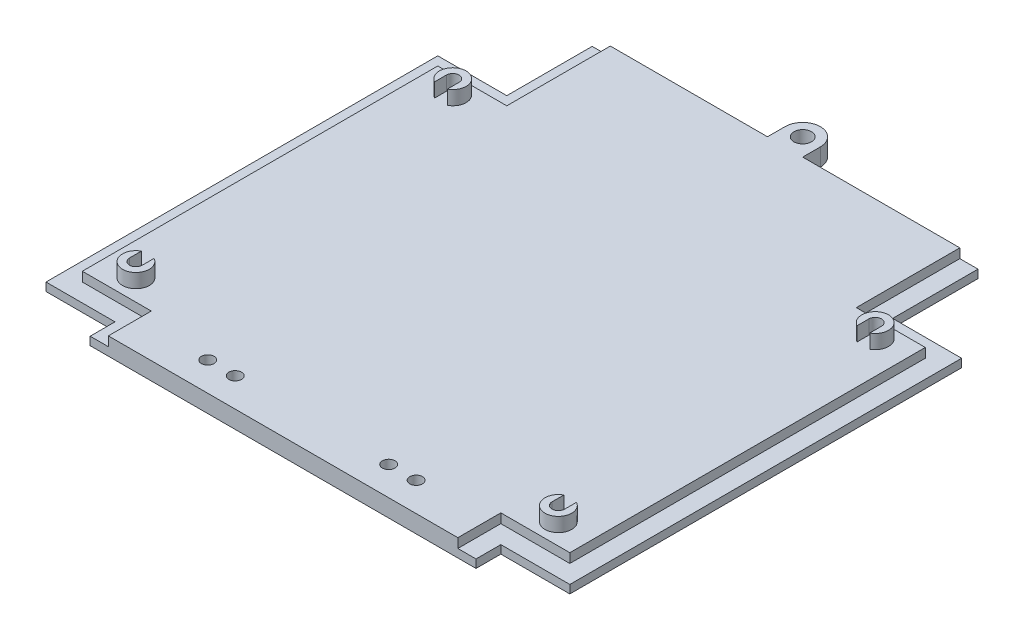
from build123d import *

# Parameters (mm, degrees)
BOSS_EXTRUDE1_DEPTH = 6.35
CUT_EXTRUDE1_DEPTH  = 3.375
SKETCH3_W           = 12.7
SKETCH3_H           = 12.7
BOSS_EXTRUDE2_DEPTH = 6.35
FILLET1_R           = 6.35
SKETCH4_R           = 3.175
CUT_EXTRUDE2_DEPTH  = 255.013969616
SKETCH5_R           = 2.286
CUT_EXTRUDE3_DEPTH  = 12.7
BOSS_EXTRUDE3_DEPTH = 5.08


with BuildPart() as part:
    # Sketch1 → Boss-Extrude1 (new body)
    with BuildSketch(Plane(origin=(0, 0, 0), x_dir=(1, 0, 0), z_dir=(0, 1, 0))):
        Polygon((0, 150.29942), (0, 181.102), (139.192, 181.102), (139.192, 150.29942), (164.084, 150.29942), (164.084, 8.95858), (139.192, 8.95858), (139.192, 0), (0, 0), (0, 8.95858), (-24.892, 8.95858), (-24.892, 150.29942), align=None)
    extrude(amount=BOSS_EXTRUDE1_DEPTH)

    # Sketch2 → Cut-Extrude1 (cut)
    with BuildSketch(Plane(origin=(0, 6.35, 0), x_dir=(1, 0, 0), z_dir=(0, 1, 0))):
        Polygon((132.6420004, 181.102), (132.6420004, 143.7494204), (157.5340004, 143.7494204), (157.5340004, 15.5085796), (132.6420004, 15.5085796), (132.6420004, 0), (139.192, 0), (139.192, 8.95858), (164.084, 8.95858), (164.084, 150.29942), (139.192, 150.29942), (139.192, 181.102), align=None)
        Polygon((0, 181.102), (6.5499996, 181.102), (6.5499996, 143.7494204), (-18.3420004, 143.7494204), (-18.3420004, 15.5085796), (6.5499996, 15.5085796), (6.5499996, 0), (0, 0), (0, 8.95858), (-24.892, 8.95858), (-24.892, 150.29942), (0, 150.29942), align=None)
    extrude(amount=-CUT_EXTRUDE1_DEPTH, mode=Mode.SUBTRACT)

    # Sketch3 → Boss-Extrude2 (add)
    with BuildSketch(Plane(origin=(0, 6.35, 0), x_dir=(1, 0, 0), z_dir=(0, 1, 0))):
        with Locations((69.596, 187.452)):
            Rectangle(SKETCH3_W, SKETCH3_H)
    extrude(amount=-BOSS_EXTRUDE2_DEPTH)

    # Fillet1
    fillet1_edges = [part.edges().sort_by_distance(p)[0] for p in [
        (63.246, 3.175, -193.802),
        (75.946, 3.175, -193.802),
    ]]
    fillet(fillet1_edges, radius=FILLET1_R - 0.0001)  # a hair under: the kernel refuses the full size

    # Sketch4 → Cut-Extrude2 (cut, through all)
    with BuildSketch(Plane(origin=(0, 6.35, 0), x_dir=(1, 0, 0), z_dir=(0, 1, 0))):
        with Locations(Location((69.596, 187.452, 0), (0, 0, 270))):
            Circle(SKETCH4_R)
    extrude(amount=-CUT_EXTRUDE2_DEPTH, mode=Mode.SUBTRACT)

    # Sketch5 → Cut-Extrude3 (cut)
    with BuildSketch(Plane.XZ):
        with Locations(Location((107.188, -10.414, 0), (0, 0, 270))):
            Circle(SKETCH5_R)
        with Locations(Location((97.282, -10.414, 0), (0, 0, 270))):
            Circle(SKETCH5_R)
        with Locations(Location((41.91, -10.414, 0), (0, 0, 270))):
            Circle(SKETCH5_R)
        with Locations(Location((32.004, -10.414, 0), (0, 0, 270))):
            Circle(SKETCH5_R)
    extrude(amount=-CUT_EXTRUDE3_DEPTH, mode=Mode.SUBTRACT)

    # Sketch6 → Boss-Extrude3 (add)
    with BuildSketch(Plane(origin=(0, 6.35, 0), x_dir=(1, 0, 0), z_dir=(0, 1, 0))):
        with BuildLine():
            Line((-4.318, 23.114), (-4.318, 27.364232935))
            ThreePointArc((-4.318, 27.364232935), (-6.604, 18.288), (-8.89, 27.364232935))
            Line((-8.89, 27.364232935), (-8.89, 23.114))
            ThreePointArc((-8.89, 23.114), (-6.604, 20.828), (-4.318, 23.114))
        make_face()
        with BuildLine():
            Line((-8.89, 137.414), (-8.89, 133.163767065))
            ThreePointArc((-8.89, 133.163767065), (-6.604, 142.24), (-4.318, 133.163767065))
            Line((-4.318, 133.163767065), (-4.318, 137.414))
            ThreePointArc((-4.318, 137.414), (-6.604, 139.7), (-8.89, 137.414))
        make_face()
        with BuildLine():
            Line((148.082, 23.114), (148.082, 27.364232935))
            ThreePointArc((148.082, 27.364232935), (145.796, 18.288), (143.51, 27.364232935))
            Line((143.51, 27.364232935), (143.51, 23.114))
            ThreePointArc((143.51, 23.114), (145.796, 20.828), (148.082, 23.114))
        make_face()
        with BuildLine():
            Line((148.082, 137.414), (148.082, 133.163767065))
            ThreePointArc((148.082, 133.163767065), (145.796, 142.24), (143.51, 133.163767065))
            Line((143.51, 133.163767065), (143.51, 137.414))
            ThreePointArc((143.51, 137.414), (145.796, 139.7), (148.082, 137.414))
        make_face()
    extrude(amount=BOSS_EXTRUDE3_DEPTH)


solid = part.part
